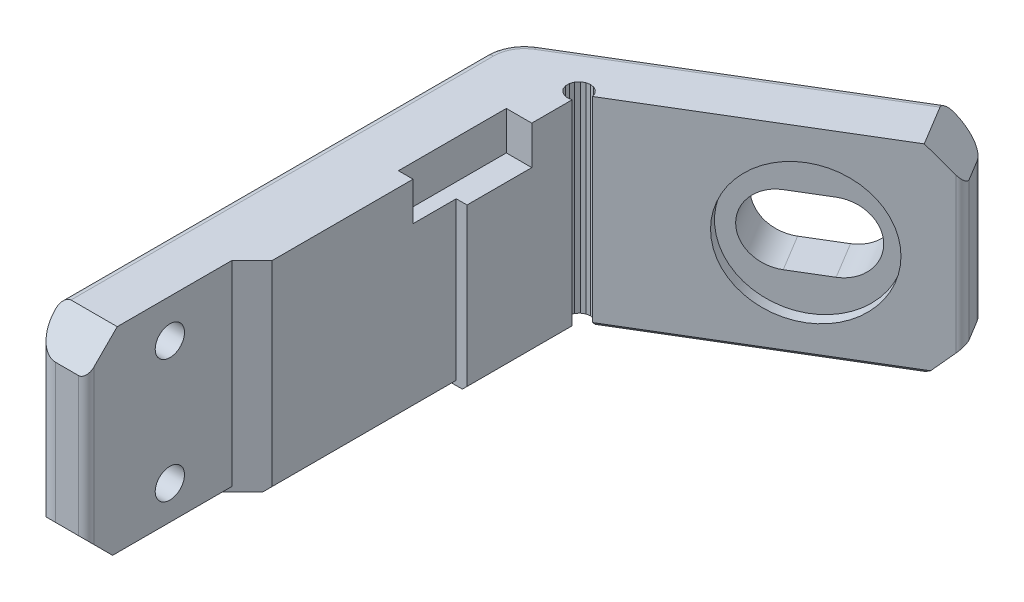
from build123d import *

# Parameters (mm, degrees)
LEG_AND_PAD_DEPTH               = 13
SCREW_HEAD_RELIEF_SKETCH_W      = 14
SCREW_HEAD_RELIEF_SKETCH_H      = 6
SCREW_HEAD_RELIEF_DEPTH         = 2.35
LENS_FRAME_RELIEF_SIDE_SKETCH_W = 2.8
LENS_FRAME_RELIEF_SIDE_SKETCH_H = 23.88
LENS_FRAME_RELIEF_SIDE_DEPTH    = 14
M6_SLOT_MIDDLE_DEPTH            = 4.5
SCREW_HOLES_SKETCH_R            = 1.9
SCREW_HOLES_DEPTH               = 4.5
LEG_TOP_CORNERS_SIZE            = 4
PAD_END_CORNERS_SIZE            = 4
OUTSIDE_OF_THE_BEND_R           = 5
LEG_TOP_OUTER_EDGE_R            = 3
PAD_END_OUTER_EDGE_R            = 3
LEG_TOP_INNER_EDGE_R            = 1
PAD_END_INNER_EDGE_R            = 1
BED_FACE_CHAMFER_SIZE           = 0.6
TOP_FACE_EDGE_R                 = 1


with BuildPart() as part:
    # leg and pad sketch → leg and pad (new, symmetric)
    with BuildSketch(Plane(origin=(0, -20.7, 0), x_dir=(1, 0, 0), z_dir=(0, 1, 0))):
        Polygon((0.551289683, 30.332713936), (0.367250577, 30.819395741), (0.028023026, 31.213926146), (-0.425575667, 31.468833575), (-0.938966578, 31.553446481), (-1.450376329, 31.457583879), (-1.898269923, 31.192780366), (-2.228754897, 30.790898227), (-2.402065893, 30.30029363), (-2.397349395, 29.779998208), (-2.215172912, 29.292616119), (-1.877456693, 28.896791249), (-1.424836191, 28.640150931), (-0.91177263, 28.55357522), (-0.4, 28.647481273), (-0.4, -7.48), (-4.42, -11.5), (-4.42, -30.37), (-11.42, -30.37), (-11.42, 31.283844582), (27.204821487, 54.594667874), (30.821788068, 48.601542416), align=None)
    extrude(amount=LEG_AND_PAD_DEPTH, both=True)

    # screw head relief sketch → screw head relief (cut, symmetric)
    with BuildSketch(Plane(origin=(-1.35, 0, 0), x_dir=(0, 0, -1), z_dir=(1, 0, 0))):
        with Locations((16.4, -9.7)):
            Rectangle(SCREW_HEAD_RELIEF_SKETCH_W, SCREW_HEAD_RELIEF_SKETCH_H)
    extrude(amount=SCREW_HEAD_RELIEF_DEPTH, both=True, mode=Mode.SUBTRACT)

    # lens frame relief, side sketch → lens frame relief, side (cut, symmetric)
    with BuildSketch(Plane(origin=(0, -20.7, 0), x_dir=(1, 0, 0), z_dir=(0, 1, 0))):
        with Locations((-0.4, 3.06)):
            Rectangle(LENS_FRAME_RELIEF_SIDE_SKETCH_W, LENS_FRAME_RELIEF_SIDE_SKETCH_H)
    extrude(amount=LENS_FRAME_RELIEF_SIDE_DEPTH, both=True, mode=Mode.SUBTRACT)

    # insert flange relief sketch → insert flange relief (revolve, cut)
    with BuildSketch(Plane(origin=(0, -20.7, 0), x_dir=(1, 0, 0), z_dir=(0, 1, 0))):
        Polygon((18.324853729, 39.891397061), (17.03307995, 42.03179901), (9.327632933, 37.381413406), (10.619406712, 35.241011457), align=None)
    revolve(axis=Axis((18.324853729, -20.7, -39.891397061), (-0.5167095115681243, 0, -0.8561607796757748)), mode=Mode.SUBTRACT)

    # M6 slot end 1 sketch → M6 slot end 1 (revolve, cut)
    with BuildSketch(Plane(origin=(0, -20.7, 0), x_dir=(1, 0, 0), z_dir=(0, 1, 0))):
        Polygon((20.465255678, 41.18317084), (15.814870074, 48.888617857), (11.962146565, 46.563425055), (16.612532169, 38.857978038), align=None)
    revolve(axis=Axis((20.465255678, -20.7, -41.18317084), (-0.5167095115681236, 0, -0.8561607796757752)), mode=Mode.SUBTRACT)

    # M6 slot end 2 sketch → M6 slot end 2 (revolve, cut)
    with BuildSketch(Plane(origin=(0, -20.7, 0), x_dir=(1, 0, 0), z_dir=(0, 1, 0))):
        Polygon((16.18445178, 38.599623282), (11.534066176, 46.305070299), (7.681342667, 43.979877497), (12.331728271, 36.27443048), align=None)
    revolve(axis=Axis((16.18445178, -20.7, -38.599623282), (-0.5167095115681234, 0, -0.8561607796757752)), mode=Mode.SUBTRACT)

    # M6 slot middle sketch → M6 slot middle (cut, symmetric)
    with BuildSketch(Plane(origin=(0, -20.7, 0), x_dir=(1, 0, 0), z_dir=(0, 1, 0))):
        Polygon((16.18445178, 38.599623282), (20.465255678, 41.18317084), (15.814870074, 48.888617857), (11.534066176, 46.305070299), align=None)
    extrude(amount=M6_SLOT_MIDDLE_DEPTH, both=True, mode=Mode.SUBTRACT)

    # screw holes sketch → screw holes (cut, symmetric)
    with BuildSketch(Plane(origin=(-7.92, 0, 0), x_dir=(0, 0, -1), z_dir=(1, 0, 0))):
        with Locations((-19.54, -28.7)):
            Circle(SCREW_HOLES_SKETCH_R)
        with Locations((-19.54, -12.7)):
            Circle(SCREW_HOLES_SKETCH_R)
    extrude(amount=SCREW_HOLES_DEPTH, both=True, mode=Mode.SUBTRACT)

    # leg top corners
    leg_top_corners_edges = [part.edges().sort_by_distance(p)[0] for p in [
        (-7.92, -7.7, 30.37),
        (-7.92, -33.7, 30.37),
    ]]
    chamfer(leg_top_corners_edges, length=LEG_TOP_CORNERS_SIZE)

    # pad end corners
    pad_end_corners_edges = [part.edges().sort_by_distance(p)[0] for p in [
        (29.013304778, -7.7, -51.598105145),
        (29.013304778, -33.7, -51.598105145),
    ]]
    chamfer(pad_end_corners_edges, length=PAD_END_CORNERS_SIZE)

    # outside of the bend
    outside_of_the_bend_edges = [part.edges().sort_by_distance(p)[0] for p in [
        (-11.42, -20.7, -31.283844582),
    ]]
    fillet(outside_of_the_bend_edges, radius=OUTSIDE_OF_THE_BEND_R)

    # leg top outer edge
    leg_top_outer_edge_edges = [part.edges().sort_by_distance(p)[0] for p in [
        (-11.42, -20.7, 30.37),
    ]]
    fillet(leg_top_outer_edge_edges, radius=LEG_TOP_OUTER_EDGE_R)

    # pad end outer edge
    pad_end_outer_edge_edges = [part.edges().sort_by_distance(p)[0] for p in [
        (27.204821487, -20.7, -54.594667874),
    ]]
    fillet(pad_end_outer_edge_edges, radius=PAD_END_OUTER_EDGE_R)

    # leg top inner edge
    leg_top_inner_edge_edges = [part.edges().sort_by_distance(p)[0] for p in [
        (-4.42, -20.7, 30.37),
    ]]
    fillet(leg_top_inner_edge_edges, radius=LEG_TOP_INNER_EDGE_R)

    # pad end inner edge
    pad_end_inner_edge_edges = [part.edges().sort_by_distance(p)[0] for p in [
        (30.821788068, -20.7, -48.601542416),
    ]]
    fillet(pad_end_inner_edge_edges, radius=PAD_END_INNER_EDGE_R)

    # bed face chamfer
    bed_face_chamfer_edges = [part.edges().sort_by_distance(p)[0] for p in [
        (13.974217317, -33.7, -38.433709153),
        (7.388315405, -33.7, -42.635024987),
        (-4.42, -33.7, 18.935),
        (-1.8, -33.7, -3.06),
        (-0.4, -33.7, -21.823740636),
        (-10.774178326, -33.7, -30.919287503),
        (-11.42, -33.7, -1.045708124),
    ]]
    chamfer(bed_face_chamfer_edges, length=BED_FACE_CHAMFER_SIZE)

    # top face edge
    top_face_edge_edges = [part.edges().sort_by_distance(p)[0] for p in [
        (7.388315405, -7.7, -42.635024987),
        (-10.774178326, -7.7, -30.919287503),
        (-11.42, -7.7, -1.045708124),
    ]]
    fillet(top_face_edge_edges, radius=TOP_FACE_EDGE_R)


solid = part.part
